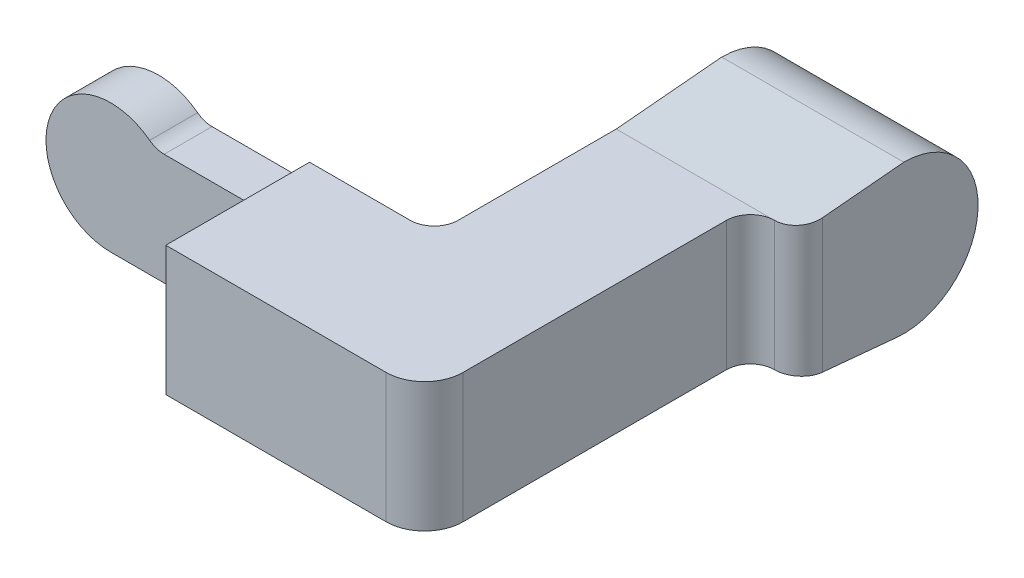
from build123d import *

# Parameters (mm, degrees)
BOSS_EXTRUDE1_DEPTH      = 13.5
BOSS_EXTRUDE1_DEPTH_BACK = 13.5
BOSS_EXTRUDE2_START      = -30
BOSS_EXTRUDE2_DEPTH      = 10
FILLET3_R                = 2
BOSS_EXTRUDE3_DEPTH      = 38
FILLET4_R                = 5
FILLET5_R                = 5


with BuildPart() as part:
    # Sketch1 → Boss-Extrude1 (new, two sides: drawn at the far end of the back side and taken through both)
    with BuildSketch(Plane(origin=(0, 0, 0), x_dir=(1, 0, 0), z_dir=(0, 1, 0)).offset(-BOSS_EXTRUDE1_DEPTH_BACK)):
        with BuildLine():
            Line((0, 0), (46, 0))
            ThreePointArc((46, 0), (51.656854249, 2.343145751), (54, 8))
            Line((54, 8), (54, 68))
            Line((54, 68), (26, 68))
            Line((26, 68), (26, 35))
            ThreePointArc((26, 35), (24.535533906, 31.464466094), (21, 30))
            Line((21, 30), (0, 30))
            Line((0, 30), (0, 15))
            Line((0, 15), (0, 0))
        make_face()
    extrude(amount=BOSS_EXTRUDE1_DEPTH + BOSS_EXTRUDE1_DEPTH_BACK)

    # Sketch2 → Boss-Extrude2 (add)
    with BuildSketch(Plane.XY.offset(BOSS_EXTRUDE2_START)):
        with BuildLine():
            Line((0, -13.5), (-31.5, -13.5))
            ThreePointArc((-31.5, -13.5), (-44.299517979, 4.292125289), (-23.361165214, 10.770764519))
            ThreePointArc((-23.361165214, 10.770764519), (-21.936457993, 10.019374349), (-20.346781961, 9.759936564))
            Line((-20.346781961, 9.759936564), (0, 9.759936564))
            Line((0, 9.759936564), (0, -13.5))
        make_face()
    extrude(amount=BOSS_EXTRUDE2_DEPTH)

    # Fillet3
    fillet3_edges = [part.edges().sort_by_distance(p)[0] for p in [
        (0, 9.759936564, -25),
        (0, -1.870031718, -20),
    ]]
    fillet(fillet3_edges, radius=FILLET3_R)

    # Sketch4 → Boss-Extrude3 (add)
    with BuildSketch(Plane.ZY.offset(-26)):
        with BuildLine():
            ThreePointArc((-90, 15.5), (-105.482977781, -0.726222431), (-88.549150224, -15.431948514))
            Line((-88.549150224, -15.431948514), (-68, -13.5))
            Line((-68, -13.5), (-68, 13.5))
            Line((-68, 13.5), (-87.204918033, 15.245901639))
            Line((-87.204918033, 15.245901639), (-90, 15.5))
        make_face()
    extrude(amount=-BOSS_EXTRUDE3_DEPTH)

    # Fillet4
    fillet4_edges = [part.edges().sort_by_distance(p)[0] for p in [
        (54, 0, -68),
    ]]
    fillet(fillet4_edges, radius=FILLET4_R)

    # Fillet5
    fillet5_edges = [part.edges().sort_by_distance(p)[0] for p in [
        (64, 0, -68),
    ]]
    fillet(fillet5_edges, radius=FILLET5_R - 0.0001)  # a hair under: the kernel refuses the full size


solid = part.part
